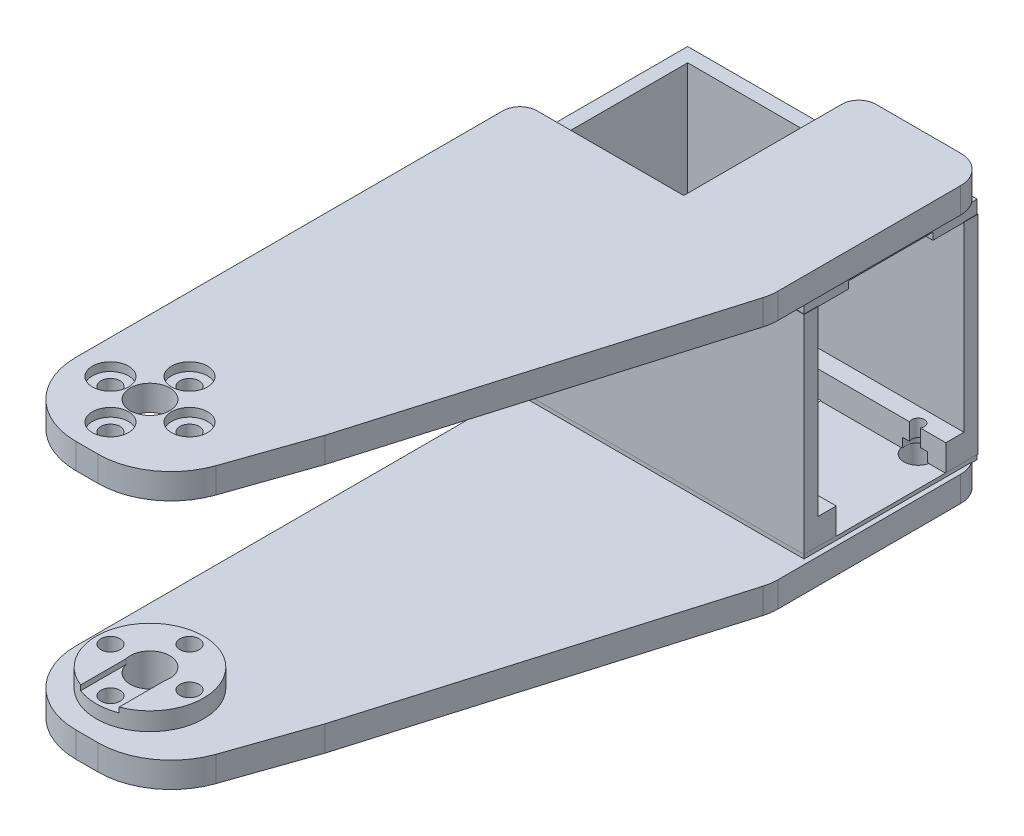
from build123d import *

# Parameters (mm, degrees)
BOSS_1_DEPTH    = 4.5
S_CYL2_R        = 9.5
BOSS_2_DEPTH    = 3.2
BOSS_3_DEPTH    = 4.5
S_BOX4_W        = 2.5
S_BOX4_H        = 36.8
BOSS_4_DEPTH    = 30.8
S_BOX5_W        = 51.4
S_BOX5_H        = 36.8
BOSS_5_DEPTH    = 2.5
S_BOX6_W        = 51.4
S_BOX6_H        = 36.8
BOSS_6_DEPTH    = 2.5
S_BOX7_W        = 51.4
S_BOX7_H        = 4.6
BOSS_7_DEPTH    = 30.8
S_BOX8_W        = 22.13
S_BOX8_H        = 2.4
BOSS_8_DEPTH    = 30.66
S_BOX9_W        = 29.16
S_BOX9_H        = 2.4
BOSS_9_DEPTH    = 1.83
S_BOX10_W       = 22.13
S_BOX10_H       = 0.95
BOSS_10_DEPTH   = 30.66
S_BOX11_W       = 29.16
S_BOX11_H       = 0.95
BOSS_11_DEPTH   = 1.83
S_HOLE12_R      = 3.5
HOLE_12_DEPTH   = 4.7
S_HOLE13_R      = 1.7
HOLE_13_DEPTH   = 4.7
S_HOLE14_R      = 1.7
HOLE_14_DEPTH   = 4.7
S_HOLE15_R      = 1.7
HOLE_15_DEPTH   = 4.7
S_HOLE16_R      = 1.7
HOLE_16_DEPTH   = 4.7
S_HOLE17_R      = 3.2
HOLE_17_DEPTH   = 1.6
S_HOLE18_R      = 3.2
HOLE_18_DEPTH   = 1.6
S_HOLE19_R      = 3.2
HOLE_19_DEPTH   = 1.6
S_HOLE20_R      = 3.2
HOLE_20_DEPTH   = 1.6
S_HOLE21_R      = 3.5
HOLE_21_DEPTH   = 7.9
S_HOLE22_R      = 1.7
HOLE_22_DEPTH   = 7.9
S_HOLE23_R      = 1.7
HOLE_23_DEPTH   = 7.9
S_HOLE24_R      = 1.7
HOLE_24_DEPTH   = 7.9
S_HOLE25_R      = 1.7
HOLE_25_DEPTH   = 7.9
S_HOLE26_R      = 3.2
HOLE_26_DEPTH   = 2.1
S_HOLE27_R      = 3.2
HOLE_27_DEPTH   = 2.1
S_HOLE28_R      = 3.2
HOLE_28_DEPTH   = 2.1
S_HOLE29_R      = 3.2
HOLE_29_DEPTH   = 2.1
S_CUT30_W       = 6.8
S_CUT30_H       = 1
POCKET_30_DEPTH = 10
S_HOLE31_R      = 10.5
HOLE_31_DEPTH   = 4.8
S_CUT32_W       = 19.5
S_CUT32_H       = 4.75
POCKET_32_DEPTH = 19.4
S_CUT33_W       = 8.3
S_CUT33_H       = 4.75
POCKET_33_DEPTH = 19.4
S_CUT34_W       = 11
S_CUT34_H       = 4.75
POCKET_34_DEPTH = 7
S_CUT35_W       = 20
S_CUT35_H       = 2.9
POCKET_35_DEPTH = 15.9
S_HOLE36_R      = 1.1
HOLE_36_DEPTH   = 4.8
S_HOLE37_R      = 2.3
HOLE_37_DEPTH   = 1.7
S_HOLE38_R      = 1.1
HOLE_38_DEPTH   = 4.8
S_HOLE39_R      = 2.3
HOLE_39_DEPTH   = 1.7
S_HOLE40_R      = 1.1
HOLE_40_DEPTH   = 4.8
S_HOLE41_R      = 2.3
HOLE_41_DEPTH   = 1.7
S_CUT42_W       = 30.6
S_CUT42_H       = 1.55
POCKET_42_DEPTH = 15
S_HOLE43_R      = 2.5
HOLE_43_DEPTH   = 5.3
S_HOLE44_R      = 2.5
HOLE_44_DEPTH   = 5.3
CUT_45_DEPTH    = 4.9
CUT_46_DEPTH    = 32


with BuildPart() as part:
    # S_prism1 → Boss_1 (new body)
    with BuildSketch(Plane(origin=(0, 18.8, 0), x_dir=(1, 0, 0), z_dir=(0, 1, 0))):
        with BuildLine():
            Line((-0.1, -13), (3.8289, -13))
            ThreePointArc((3.8289, -13), (11.303548347, -10.613765629), (16.0129, -4.3379))
            Line((16.0129, -4.3379), (21, 10))
            Line((21, 10), (38.6729, 69.8916))
            ThreePointArc((38.6729, 69.8916), (38.917799599, 71.011897227), (39, 72.1557))
            Line((39, 72.1557), (39, 104.5))
            ThreePointArc((39, 104.5), (37.5355, 108.0355), (34, 109.5))
            Line((34, 109.5), (19, 109.5))
            ThreePointArc((19, 109.5), (16.8787, 108.6213), (16, 106.5))
            Line((16, 106.5), (16, 78.5))
            Line((16, 78.5), (-10, 78.5))
            ThreePointArc((-10, 78.5), (-12.1213, 77.6213), (-13, 75.5))
            Line((-13, 75.5), (-13, -0.1))
            ThreePointArc((-13, -0.1), (-9.2217, -9.2217), (-0.1, -13))
        make_face()
    extrude(amount=BOSS_1_DEPTH)



with BuildPart() as body_2:
    # S_cyl2 → Boss_2 (new body)
    with BuildSketch(Plane(origin=(0, -20.95, 0), x_dir=(1, 0, 0), z_dir=(0, 1, 0))):
        Circle(S_CYL2_R)
    extrude(amount=BOSS_2_DEPTH)

    # S_prism3 → Boss_3 (add)
    with BuildSketch(Plane(origin=(0, -25.45, 0), x_dir=(1, 0, 0), z_dir=(0, 1, 0))):
        with BuildLine():
            Line((-0.1, -13), (3.8289, -13))
            ThreePointArc((3.8289, -13), (11.303548347, -10.613765629), (16.0129, -4.3379))
            Line((16.0129, -4.3379), (21, 10))
            Line((21, 10), (38.6729, 69.8916))
            ThreePointArc((38.6729, 69.8916), (38.917799599, 71.011897227), (39, 72.1557))
            Line((39, 72.1557), (39, 104.5))
            ThreePointArc((39, 104.5), (37.5355, 108.0355), (34, 109.5))
            Line((34, 109.5), (19, 109.5))
            ThreePointArc((19, 109.5), (16.8787, 108.6213), (16, 106.5))
            Line((16, 106.5), (16, 78.5))
            Line((16, 78.5), (-10, 78.5))
            ThreePointArc((-10, 78.5), (-12.1213, 77.6213), (-13, 75.5))
            Line((-13, 75.5), (-13, -0.1))
            ThreePointArc((-13, -0.1), (-9.2217, -9.2217), (-0.1, -13))
        make_face()
    extrude(amount=BOSS_3_DEPTH)


with BuildPart() as body_3:
    # S_box4 → Boss_4 (new body)
    with BuildSketch(Plane.XY.offset(-108.4)):
        with Locations((-11.95, -1.8)):
            Rectangle(S_BOX4_W, S_BOX4_H)
    extrude(amount=BOSS_4_DEPTH)

    # S_box5 → Boss_5 (add)
    with BuildSketch(Plane.XY.offset(-108.4)):
        with Locations((12.5, -1.8)):
            Rectangle(S_BOX5_W, S_BOX5_H)
    extrude(amount=BOSS_5_DEPTH)

    # S_box6 → Boss_6 (add)
    with BuildSketch(Plane.XY.offset(-80.1)):
        with Locations((12.5, -1.8)):
            Rectangle(S_BOX6_W, S_BOX6_H)
    extrude(amount=BOSS_6_DEPTH)

    # S_box7 → Boss_7 (add)
    with BuildSketch(Plane.XY.offset(-108.4)):
        with Locations((12.5, -17.9)):
            Rectangle(S_BOX7_W, S_BOX7_H)
    extrude(amount=BOSS_7_DEPTH)


with BuildPart() as part_1:
    add(part.part)

    add(body_3.part)  # Boss_8 merges body 3
    # S_box8 → Boss_8 (add)
    with BuildSketch(Plane.XY.offset(-108.33)):
        with Locations((27.065, 17.7)):
            Rectangle(S_BOX8_W, S_BOX8_H)
    extrude(amount=BOSS_8_DEPTH)

    # S_box9 → Boss_9 (add)
    with BuildSketch(Plane.XY.offset(-79.5)):
        with Locations((1.45, 17.7)):
            Rectangle(S_BOX9_W, S_BOX9_H)
    extrude(amount=BOSS_9_DEPTH)


    add(body_2.part)  # Boss_10 merges body 2
    # S_box10 → Boss_10 (add)
    with BuildSketch(Plane.XY.offset(-108.33)):
        with Locations((27.065, -20.575)):
            Rectangle(S_BOX10_W, S_BOX10_H)
    extrude(amount=BOSS_10_DEPTH)

    # S_box11 → Boss_11 (add)
    with BuildSketch(Plane.XY.offset(-79.5)):
        with Locations((1.45, -20.575)):
            Rectangle(S_BOX11_W, S_BOX11_H)
    extrude(amount=BOSS_11_DEPTH)

    # S_hole12 → Hole_12 (cut)
    with BuildSketch(Plane(origin=(0, 18.7, 0), x_dir=(1, 0, 0), z_dir=(0, 1, 0))):
        Circle(S_HOLE12_R)
    extrude(amount=HOLE_12_DEPTH, mode=Mode.SUBTRACT)

    # S_hole13 → Hole_13 (cut)
    with BuildSketch(Plane(origin=(0, 18.7, 0), x_dir=(1, 0, 0), z_dir=(0, 1, 0))):
        with Locations((7, 0)):
            Circle(S_HOLE13_R)
    extrude(amount=HOLE_13_DEPTH, mode=Mode.SUBTRACT)

    # S_hole14 → Hole_14 (cut)
    with BuildSketch(Plane(origin=(0, 18.7, 0), x_dir=(1, 0, 0), z_dir=(0, 1, 0))):
        with Locations((0, -7)):
            Circle(S_HOLE14_R)
    extrude(amount=HOLE_14_DEPTH, mode=Mode.SUBTRACT)

    # S_hole15 → Hole_15 (cut)
    with BuildSketch(Plane(origin=(0, 18.7, 0), x_dir=(1, 0, 0), z_dir=(0, 1, 0))):
        with Locations((-7, 0)):
            Circle(S_HOLE15_R)
    extrude(amount=HOLE_15_DEPTH, mode=Mode.SUBTRACT)

    # S_hole16 → Hole_16 (cut)
    with BuildSketch(Plane(origin=(0, 18.7, 0), x_dir=(1, 0, 0), z_dir=(0, 1, 0))):
        with Locations((0, 7)):
            Circle(S_HOLE16_R)
    extrude(amount=HOLE_16_DEPTH, mode=Mode.SUBTRACT)

    # S_hole17 → Hole_17 (cut)
    with BuildSketch(Plane(origin=(0, 21.8, 0), x_dir=(1, 0, 0), z_dir=(0, 1, 0))):
        with Locations((7, 0)):
            Circle(S_HOLE17_R)
    extrude(amount=HOLE_17_DEPTH, mode=Mode.SUBTRACT)

    # S_hole18 → Hole_18 (cut)
    with BuildSketch(Plane(origin=(0, 21.8, 0), x_dir=(1, 0, 0), z_dir=(0, 1, 0))):
        with Locations((0, -7)):
            Circle(S_HOLE18_R)
    extrude(amount=HOLE_18_DEPTH, mode=Mode.SUBTRACT)

    # S_hole19 → Hole_19 (cut)
    with BuildSketch(Plane(origin=(0, 21.8, 0), x_dir=(1, 0, 0), z_dir=(0, 1, 0))):
        with Locations((-7, 0)):
            Circle(S_HOLE19_R)
    extrude(amount=HOLE_19_DEPTH, mode=Mode.SUBTRACT)

    # S_hole20 → Hole_20 (cut)
    with BuildSketch(Plane(origin=(0, 21.8, 0), x_dir=(1, 0, 0), z_dir=(0, 1, 0))):
        with Locations((0, 7)):
            Circle(S_HOLE20_R)
    extrude(amount=HOLE_20_DEPTH, mode=Mode.SUBTRACT)

    # S_hole21 → Hole_21 (cut)
    with BuildSketch(Plane(origin=(0, -25.55, 0), x_dir=(1, 0, 0), z_dir=(0, 1, 0))):
        Circle(S_HOLE21_R)
    extrude(amount=HOLE_21_DEPTH, mode=Mode.SUBTRACT)

    # S_hole22 → Hole_22 (cut)
    with BuildSketch(Plane(origin=(0, -25.55, 0), x_dir=(1, 0, 0), z_dir=(0, 1, 0))):
        with Locations((7, 0)):
            Circle(S_HOLE22_R)
    extrude(amount=HOLE_22_DEPTH, mode=Mode.SUBTRACT)

    # S_hole23 → Hole_23 (cut)
    with BuildSketch(Plane(origin=(0, -25.55, 0), x_dir=(1, 0, 0), z_dir=(0, 1, 0))):
        with Locations((0, -7)):
            Circle(S_HOLE23_R)
    extrude(amount=HOLE_23_DEPTH, mode=Mode.SUBTRACT)

    # S_hole24 → Hole_24 (cut)
    with BuildSketch(Plane(origin=(0, -25.55, 0), x_dir=(1, 0, 0), z_dir=(0, 1, 0))):
        with Locations((-7, 0)):
            Circle(S_HOLE24_R)
    extrude(amount=HOLE_24_DEPTH, mode=Mode.SUBTRACT)

    # S_hole25 → Hole_25 (cut)
    with BuildSketch(Plane(origin=(0, -25.55, 0), x_dir=(1, 0, 0), z_dir=(0, 1, 0))):
        with Locations((0, 7)):
            Circle(S_HOLE25_R)
    extrude(amount=HOLE_25_DEPTH, mode=Mode.SUBTRACT)

    # S_hole26 → Hole_26 (cut)
    with BuildSketch(Plane(origin=(0, -25.55, 0), x_dir=(1, 0, 0), z_dir=(0, 1, 0))):
        with Locations((7, 0)):
            Circle(S_HOLE26_R)
    extrude(amount=HOLE_26_DEPTH, mode=Mode.SUBTRACT)

    # S_hole27 → Hole_27 (cut)
    with BuildSketch(Plane(origin=(0, -25.55, 0), x_dir=(1, 0, 0), z_dir=(0, 1, 0))):
        with Locations((0, -7)):
            Circle(S_HOLE27_R)
    extrude(amount=HOLE_27_DEPTH, mode=Mode.SUBTRACT)

    # S_hole28 → Hole_28 (cut)
    with BuildSketch(Plane(origin=(0, -25.55, 0), x_dir=(1, 0, 0), z_dir=(0, 1, 0))):
        with Locations((-7, 0)):
            Circle(S_HOLE28_R)
    extrude(amount=HOLE_28_DEPTH, mode=Mode.SUBTRACT)

    # S_hole29 → Hole_29 (cut)
    with BuildSketch(Plane(origin=(0, -25.55, 0), x_dir=(1, 0, 0), z_dir=(0, 1, 0))):
        with Locations((0, 7)):
            Circle(S_HOLE29_R)
    extrude(amount=HOLE_29_DEPTH, mode=Mode.SUBTRACT)

    # S_cut30 → Pocket_30 (cut)
    with BuildSketch(Plane.XY):
        with Locations((0, -18.15)):
            Rectangle(S_CUT30_W, S_CUT30_H)
    extrude(amount=POCKET_30_DEPTH, mode=Mode.SUBTRACT)

    # S_hole31 → Hole_31 (cut)
    with BuildSketch(Plane(origin=(0, -20.3, 0), x_dir=(1, 0, 0), z_dir=(0, 1, 0))):
        with Locations((0, 93)):
            Circle(S_HOLE31_R)
    extrude(amount=HOLE_31_DEPTH, mode=Mode.SUBTRACT)

    # S_cut32 → Pocket_32 (cut)
    with BuildSketch(Plane.XY.offset(-102.7)):
        with Locations((20.65, -17.925)):
            Rectangle(S_CUT32_W, S_CUT32_H)
    extrude(amount=POCKET_32_DEPTH, mode=Mode.SUBTRACT)

    # S_cut33 → Pocket_33 (cut)
    with BuildSketch(Plane.XY.offset(-102.7)):
        with Locations((34.55, -17.925)):
            Rectangle(S_CUT33_W, S_CUT33_H)
    extrude(amount=POCKET_33_DEPTH, mode=Mode.SUBTRACT)

    # S_cut34 → Pocket_34 (cut)
    with BuildSketch(Plane.XY.offset(-96.5)):
        with Locations((5.5, -17.925)):
            Rectangle(S_CUT34_W, S_CUT34_H)
    extrude(amount=POCKET_34_DEPTH, mode=Mode.SUBTRACT)

    # S_cut35 → Pocket_35 (cut)
    with BuildSketch(Plane.XY.offset(-108.9)):
        with Locations((0, -18.95)):
            Rectangle(S_CUT35_W, S_CUT35_H)
    extrude(amount=POCKET_35_DEPTH, mode=Mode.SUBTRACT)

    # S_hole36 → Hole_36 (cut)
    with BuildSketch(Plane(origin=(0, -20.3, 0), x_dir=(1, 0, 0), z_dir=(0, 1, 0))):
        with Locations((8.3, 82.75)):
            Circle(S_HOLE36_R)
    extrude(amount=HOLE_36_DEPTH, mode=Mode.SUBTRACT)

    # S_hole37 → Hole_37 (cut)
    with BuildSketch(Plane(origin=(0, -20.3, 0), x_dir=(1, 0, 0), z_dir=(0, 1, 0))):
        with Locations((8.3, 82.75)):
            Circle(S_HOLE37_R)
    extrude(amount=HOLE_37_DEPTH, mode=Mode.SUBTRACT)

    # S_hole38 → Hole_38 (cut)
    with BuildSketch(Plane(origin=(0, -20.3, 0), x_dir=(1, 0, 0), z_dir=(0, 1, 0))):
        with Locations((32.75, 103.25)):
            Circle(S_HOLE38_R)
    extrude(amount=HOLE_38_DEPTH, mode=Mode.SUBTRACT)

    # S_hole39 → Hole_39 (cut)
    with BuildSketch(Plane(origin=(0, -20.3, 0), x_dir=(1, 0, 0), z_dir=(0, 1, 0))):
        with Locations((32.75, 103.25)):
            Circle(S_HOLE39_R)
    extrude(amount=HOLE_39_DEPTH, mode=Mode.SUBTRACT)

    # S_hole40 → Hole_40 (cut)
    with BuildSketch(Plane(origin=(0, -20.3, 0), x_dir=(1, 0, 0), z_dir=(0, 1, 0))):
        with Locations((32.75, 82.75)):
            Circle(S_HOLE40_R)
    extrude(amount=HOLE_40_DEPTH, mode=Mode.SUBTRACT)

    # S_hole41 → Hole_41 (cut)
    with BuildSketch(Plane(origin=(0, -20.3, 0), x_dir=(1, 0, 0), z_dir=(0, 1, 0))):
        with Locations((32.75, 82.75)):
            Circle(S_HOLE41_R)
    extrude(amount=HOLE_41_DEPTH, mode=Mode.SUBTRACT)

    # S_cut42 → Pocket_42 (cut)
    with BuildSketch(Plane.XY.offset(-100.5)):
        with Locations((23.4, 16.975)):
            Rectangle(S_CUT42_W, S_CUT42_H)
    extrude(amount=POCKET_42_DEPTH, mode=Mode.SUBTRACT)

    # S_hole43 → Hole_43 (cut)
    with BuildSketch(Plane(origin=(0, -25.55, 0), x_dir=(1, 0, 0), z_dir=(0, 1, 0))):
        with Locations((32.75, 103.25)):
            Circle(S_HOLE43_R)
    extrude(amount=HOLE_43_DEPTH, mode=Mode.SUBTRACT)

    # S_hole44 → Hole_44 (cut)
    with BuildSketch(Plane(origin=(0, -25.55, 0), x_dir=(1, 0, 0), z_dir=(0, 1, 0))):
        with Locations((32.75, 82.75)):
            Circle(S_HOLE44_R)
    extrude(amount=HOLE_44_DEPTH, mode=Mode.SUBTRACT)

    # S_pcut45 → Cut_45 (cut)
    with BuildSketch(Plane(origin=(0, -20.4, 0), x_dir=(1, 0, 0), z_dir=(0, 1, 0))):
        with BuildLine():
            Line((0.5, 109.308), (0.5, 113))
            Line((0.5, 113), (-20, 113))
            Line((-20, 113), (-20, 93))
            Line((-20, 93), (-16.3, 93))
            ThreePointArc((-16.3, 93), (-11.34548413, 104.703431775), (0.5, 109.308))
        make_face()
    extrude(amount=CUT_45_DEPTH, mode=Mode.SUBTRACT)

    # S_pcut46 → Cut_46 (cut)
    with BuildSketch(Plane(origin=(0, -15.6, 0), x_dir=(1, 0, 0), z_dir=(0, 1, 0))):
        with BuildLine():
            Line((0.5, 111.508), (0.5, 113))
            Line((0.5, 113), (-20, 113))
            Line((-20, 113), (-20, 93))
            Line((-20, 93), (-18.5, 93))
            ThreePointArc((-18.5, 93), (-12.901369895, 106.259080398), (0.5, 111.508))
        make_face()
    extrude(amount=CUT_46_DEPTH, mode=Mode.SUBTRACT)


solid = part_1.part
